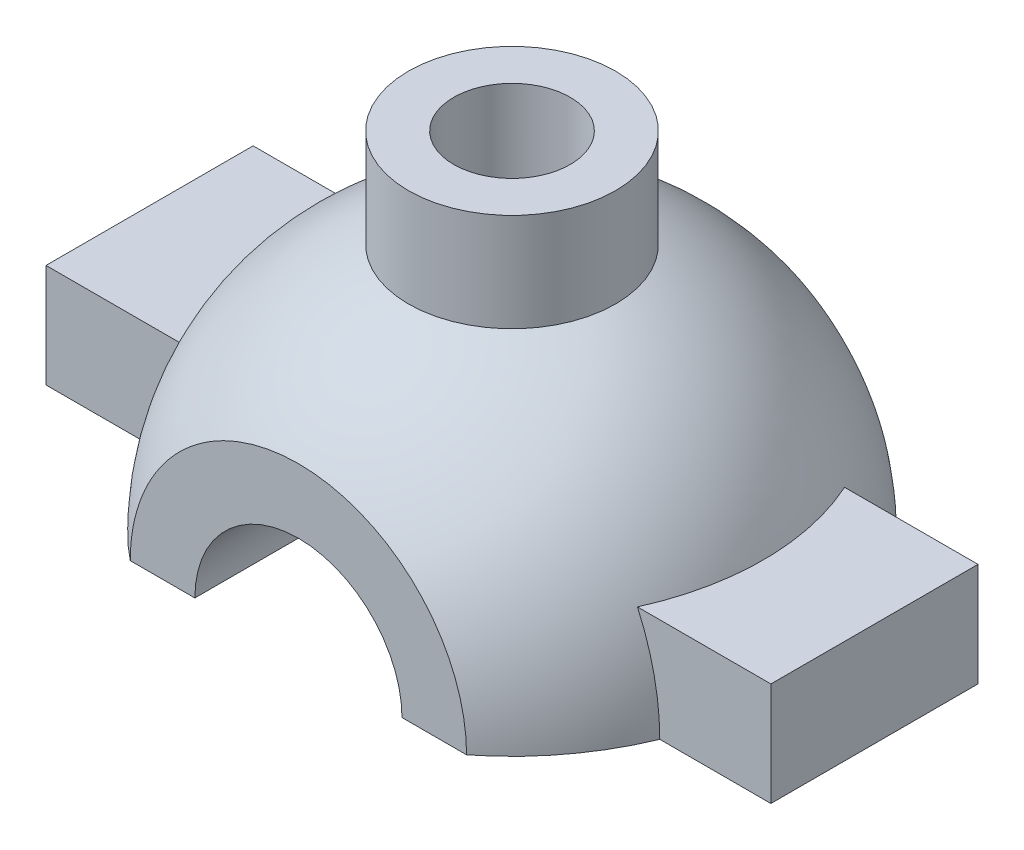
from build123d import *

# Parameters (mm, degrees)
REVOLVE_2_ANGLE         = 180
EXTRUDE_1_REACH         = 59.297
EXTRUDE_1_END_RADIUS    = 21
SKETCH_3_W              = 16
SKETCH_3_H              = 8
EXTRUDE_2_REACH         = 46.204
EXTRUDE_2_END_RADIUS    = 21
SKETCH_6_R              = 8
SKETCH_7_R              = 4.5
CUT_EXTRUDE_1_DEPTH     = 45.204072223
SKETCH_8_R              = 8
CUT_EXTRUDE_2_DEPTH     = 2500
CUT_EXTRUDE_START       = -27
CUT_EXTRUDE_3_OUTLINE_W = 28
CUT_EXTRUDE_3_OUTLINE_H = 4.5
CUT_EXTRUDE_3_DEPTH     = 12.990381057


# Read off the part's stored shape, not the designer's step: 切除-拉伸3
with BuildPart() as part:
    # 草图2 → 旋转2 (revolve)
    with BuildSketch(Plane(origin=(0, 0, 0), x_dir=(1, 0, 0), z_dir=(0, 1, 0))):
        with BuildLine():
            Line((-2.539892785, -20.845837586), (2.539892785, 20.845837586))
            ThreePointArc((2.539892785, 20.845837586), (-20.845837586, 2.539892785), (-2.539892785, -20.845837586))
        make_face()
    revolve(axis=Axis((-2.539892785, 0, 20.845837586), (0.12094727545633621, 0, -0.9926589326448885)), revolution_arc=REVOLVE_2_ANGLE)

    # 凸台-拉伸1: up to this sphere (the profile starts outside it)
    extrude_1_end = Location((0, 0, 0)) * Sphere(EXTRUDE_1_END_RADIUS, mode=Mode.PRIVATE)
    # 草图3 → 凸台-拉伸1 (add, up to the surface)
    with BuildSketch(Plane(origin=(28, 0, 0), x_dir=(0, 0, -1), z_dir=(1, 0, 0)), mode=Mode.PRIVATE) as extrude_1_sk1:
        with Locations((0, 4)):
            Rectangle(SKETCH_3_W, SKETCH_3_H)
    extrude_1_tool1 = extrude(extrude_1_sk1.sketch, amount=-EXTRUDE_1_REACH, mode=Mode.PRIVATE) - extrude_1_end
    extrude_1 = extrude_1_tool1.solids().sort_by_distance((28, 4, 0))[0]
    add(extrude_1)

    # 镜向1: 凸台-拉伸1 across plane
    add(extrude_1.mirror(Plane(origin=(0, 0, 0), x_dir=(0, 0, 1), z_dir=(1, 0, 0))))

    # 凸台-拉伸2: up to this sphere (the profile starts outside it)
    extrude_2_end = Location((0, 0, 0)) * Sphere(EXTRUDE_2_END_RADIUS, mode=Mode.PRIVATE)
    # 草图6 → 凸台-拉伸2 (add, up to the surface)
    with BuildSketch(Plane(origin=(0, 27, 0), x_dir=(1, 0, 0), z_dir=(0, 1, 0)), mode=Mode.PRIVATE) as extrude_2_sk1:
        with Locations(Location((0, 0, 0), (0, 0, 270))):
            Circle(SKETCH_6_R)
    extrude_2_tool1 = extrude(extrude_2_sk1.sketch, amount=-EXTRUDE_2_REACH, mode=Mode.PRIVATE) - extrude_2_end
    add(extrude_2_tool1.solids().sort_by_distance((0, 27, 0))[0])

    # 草图7 → 切除-拉伸1 (cut, through all)
    with BuildSketch(Plane(origin=(0, 27, 0), x_dir=(1, 0, 0), z_dir=(0, 1, 0))):
        with Locations(Location((0, 0, 0), (0, 0, 270))):
            Circle(SKETCH_7_R)
    extrude(amount=-CUT_EXTRUDE_1_DEPTH, mode=Mode.SUBTRACT)

    # 草图8 → 切除-拉伸2 (cut, symmetric)
    with BuildSketch(Plane.XY):
        Circle(SKETCH_8_R)
    extrude(amount=CUT_EXTRUDE_2_DEPTH, both=True, mode=Mode.SUBTRACT)

    # 切除-拉伸3 outline → 切除-拉伸3 (cut)
    with BuildSketch(Plane(origin=(0, 27, 0), x_dir=(1, 0, 0), z_dir=(0, 1, 0)).offset(CUT_EXTRUDE_START)):
        with Locations((0, 18.75)):
            Rectangle(CUT_EXTRUDE_3_OUTLINE_W, CUT_EXTRUDE_3_OUTLINE_H)
        with Locations((0, -18.75)):
            Rectangle(CUT_EXTRUDE_3_OUTLINE_W, CUT_EXTRUDE_3_OUTLINE_H)
    extrude(amount=CUT_EXTRUDE_3_DEPTH, mode=Mode.SUBTRACT)


solid = part.part
